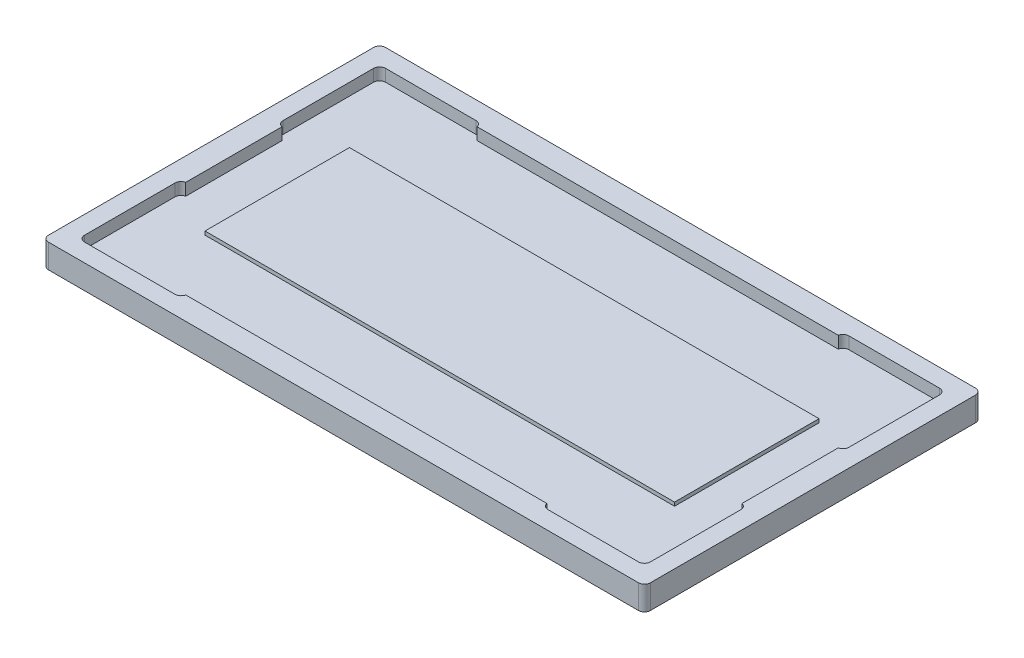
from build123d import *

# Parameters (mm, degrees)
SKETCH_1_W           = 50
SKETCH_1_H           = 28
EXTRUDE_1_DEPTH      = 6
CUT_EXTRUDE_1_DEPTH  = 1
FILLET_3_R           = 0.5
SKETCH_5_OUTSIDE_W   = 63.524
SKETCH_5_OUTSIDE_H   = 41.524
SKETCH_5_OUTSIDE_W_2 = 40
SKETCH_5_OUTSIDE_H_2 = 13
CUT_EXTRUDE_2_DEPTH  = 4
FILLET_1_R           = 0.5
SKETCH_6_W           = 39
SKETCH_6_H           = 12
EXTRUDE_2_DEPTH      = 0.3


with BuildPart() as part:
    # 草图1 → 凸台-拉伸1 (new body)
    with BuildSketch(Plane(origin=(0, 0, 0), x_dir=(1, 0, 0), z_dir=(0, 1, 0))):
        with Locations((23, -12)):
            Rectangle(SKETCH_1_W, SKETCH_1_H)
    extrude(amount=EXTRUDE_1_DEPTH)

    # 草图3 → 切除-拉伸1 (cut)
    with BuildSketch(Plane(origin=(0, 6, 0), x_dir=(1, 0, 0), z_dir=(0, 1, 0))):
        Polygon((-0.5, 0.5), (8, 0.5), (8, 0.1), (38, 0.1), (38, 0.5), (46.5, 0.5), (46.5, -8), (46.1, -8), (46.1, -16), (46.5, -16), (46.5, -24.5), (38, -24.5), (38, -24.1), (8, -24.1), (8, -24.5), (-0.5, -24.5), (-0.5, -16), (-0.1, -16), (-0.1, -8), (-0.5, -8), align=None)
    extrude(amount=-CUT_EXTRUDE_1_DEPTH, mode=Mode.SUBTRACT)

    # 圆角3
    # the kernel refuses this fillet: 0.5 mm, written as the material it adds along each edge
    with BuildSketch(Plane(origin=(38, 6, -0.5), x_dir=(1.6520118606416786e-12, 0, 1.0), z_dir=(0, -1, 0)), Plane(origin=(46.5, 6, 16), x_dir=(-1.0, 0, 1.5276668818837323e-12), z_dir=(0, -1, 0)), Plane(origin=(8, 6, 24.5), x_dir=(-1.5765166949672239e-12, 0, -1.0), z_dir=(0, -1, 0)), Plane(origin=(-0.5, 6, 8), x_dir=(1.0, 0, -1.5831780331149617e-12), z_dir=(0, -1, 0))) as fillet_3_piece_1:
        with BuildLine():
            CenterArc((0.5, -0.489897949), FILLET_3_R, 101.536959033, 78.463040967)
            Line((0, -0.489897949), (-0.01, -0.489897949))
            Line((-0.01, -0.489897949), (-0.01, 0))
            Line((-0.01, 0), (0, 0.01))
            ThreePointArc((0, 0.01), (0.2, 0.01), (0.398, 0.009797959))
            Line((0.398, 0.009797959), (0.4, 0))
        make_face()
    extrude(amount=2.224744871)
    with BuildSketch(Plane(origin=(46.5, 6, 8), x_dir=(0, 0, -1), z_dir=(0, -1, 0)), Plane(origin=(38, 6, 24.5), x_dir=(1, 0, 0), z_dir=(0, -1, 0)), Plane(origin=(-0.5, 6, 16), x_dir=(0, 0, 1), z_dir=(0, -1, 0)), Plane(origin=(8, 6, -0.5), x_dir=(-1, 0, 0), z_dir=(0, -1, 0))) as fillet_3_piece_2:
        with BuildLine():
            CenterArc((0.489897949, -0.5), FILLET_3_R, 90, 78.463040967)
            Line((0, -0.4), (-0.009797959, -0.398))
            ThreePointArc((-0.009797959, -0.398), (-0.01, -0.2), (-0.01, 0))
            Line((-0.01, 0), (0, 0.01))
            Line((0, 0.01), (0.489897949, 0.01))
            Line((0.489897949, 0.01), (0.489897949, 0))
        make_face()
    extrude(amount=2.224744871)
    with BuildSketch(Plane(origin=(46.5, 6, -0.5), x_dir=(-1, 0, 0), z_dir=(0, -1, 0)), Plane(origin=(46.5, 6, 24.5), x_dir=(0, 0, -1), z_dir=(0, -1, 0)), Plane(origin=(-0.5, 6, 24.5), x_dir=(1, 0, 0), z_dir=(0, -1, 0))) as fillet_3_piece_3:
        with BuildLine():
            CenterArc((FILLET_3_R, -FILLET_3_R), FILLET_3_R, 90, 90)
            Line((0, -FILLET_3_R), (-FILLET_3_R * 0.02, -FILLET_3_R))
            Line((-FILLET_3_R * 0.02, -FILLET_3_R), (-FILLET_3_R * 0.02, FILLET_3_R * 0.02))
            Line((-FILLET_3_R * 0.02, FILLET_3_R * 0.02), (FILLET_3_R, FILLET_3_R * 0.02))
            Line((FILLET_3_R, FILLET_3_R * 0.02), (FILLET_3_R, 0))
        make_face()
    extrude(amount=2.25)
    with BuildSketch(Plane(origin=(-0.5, 6, -0.5), x_dir=(1, 0, 0), z_dir=(0, -1, 0))) as fillet_3_piece_4:
        with BuildLine():
            CenterArc((FILLET_3_R, FILLET_3_R), FILLET_3_R, 180, 90)
            Line((0, FILLET_3_R), (-FILLET_3_R * 0.02, FILLET_3_R))
            Line((-FILLET_3_R * 0.02, FILLET_3_R), (-FILLET_3_R * 0.02, -FILLET_3_R * 0.02))
            Line((-FILLET_3_R * 0.02, -FILLET_3_R * 0.02), (FILLET_3_R, -FILLET_3_R * 0.02))
            Line((FILLET_3_R, -FILLET_3_R * 0.02), (FILLET_3_R, 0))
        make_face()
    extrude(amount=2.25)

    # 草图5 outside → 切除-拉伸2 (cut)
    with BuildSketch(Plane(origin=(0, 0, 0), x_dir=(-1, 0, 0), z_dir=(0, -1, 0))):
        with Locations((-23, -12)):
            Rectangle(SKETCH_5_OUTSIDE_W, SKETCH_5_OUTSIDE_H)
        with Locations((-23, -12)):
            Rectangle(SKETCH_5_OUTSIDE_W_2, SKETCH_5_OUTSIDE_H_2, mode=Mode.SUBTRACT)
    extrude(amount=-CUT_EXTRUDE_2_DEPTH, mode=Mode.SUBTRACT)

    # 圆角1
    fillet_1_edges = [part.edges().sort_by_distance(p)[0] for p in [
        (43, 2, 5.5),
        (3, 2, 5.5),
        (3, 2, 18.5),
        (43, 2, 18.5),
        (-2, 5, -2),
        (48, 5, -2),
        (48, 5, 26),
        (-2, 5, 26),
    ]]
    fillet(fillet_1_edges, radius=FILLET_1_R)

    # 草图6 → 凸台-拉伸2 (add)
    with BuildSketch(Plane(origin=(0, 5, 0), x_dir=(1, 0, 0), z_dir=(0, 1, 0))):
        with Locations((23, -12)):
            Rectangle(SKETCH_6_W, SKETCH_6_H)
    extrude(amount=EXTRUDE_2_DEPTH)


solid = part.part
